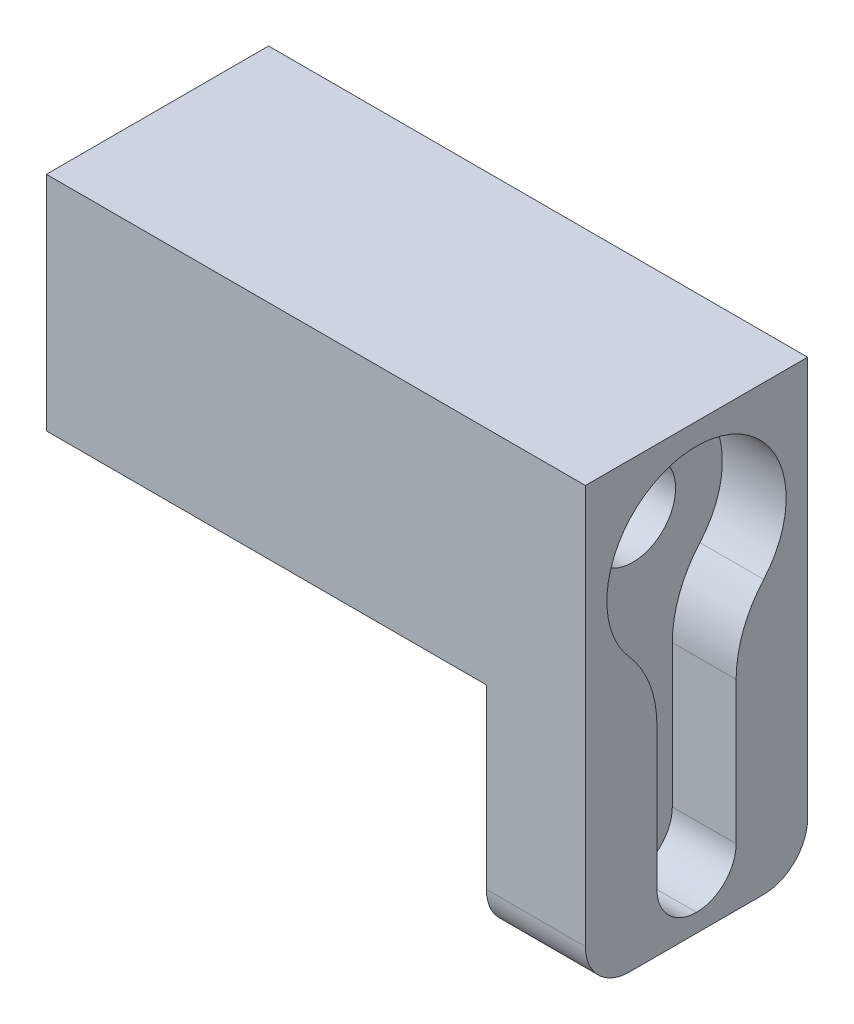
from build123d import *

# Parameters (mm, degrees)
SKETCH1_W           = 20
SKETCH1_H           = 20
BOSS_EXTRUDE1_DEPTH = 20
SKETCH2_W           = 45
SKETCH2_H           = 70
BOSS_EXTRUDE2_DEPTH = 9
CUT_EXTRUDE1_DEPTH  = 5.8
FILLET1_R           = 3.6
FILLET2_R           = 10
SKETCH5_R           = 3.9
CUT_EXTRUDE2_DEPTH  = 51.717354032
CUT_EXTRUDE3_REACH  = 49.639
SKETCH6_R           = 1.75
SKETCH7_W           = 9
SKETCH7_H           = 45
CUT_EXTRUDE4_DEPTH  = 4.8
SKETCH9_W           = 9
SKETCH9_H           = 45
CUT_EXTRUDE5_DEPTH  = 23.8
SKETCH10_W          = 12.5
SKETCH10_H          = 41.4
CUT_EXTRUDE6_DEPTH  = 23.8
SKETCH11_W          = 20
SKETCH11_H          = 1.2
CUT_EXTRUDE7_DEPTH  = 23.8
BOSS_EXTRUDE3_START = 20
SKETCH12_W          = 20
SKETCH12_H          = 20
SKETCH12_R          = 3.9
BOSS_EXTRUDE3_DEPTH = 20
SKETCH13_W          = 20.2
SKETCH13_H          = 20.2
SKETCH13_R          = 3.9
BOSS_EXTRUDE4_DEPTH = 40
SKETCH14_W          = 9
SKETCH14_H          = 20
BOSS_EXTRUDE5_DEPTH = 0.1
SKETCH15_W          = 9
SKETCH15_H          = 40.3
BOSS_EXTRUDE6_DEPTH = 0.1
SKETCH16_W          = 9
SKETCH16_H          = 40.3
BOSS_EXTRUDE7_DEPTH = 0.1
SKETCH17_R          = 4.83091966
BOSS_EXTRUDE8_DEPTH = 39
SKETCH18_R          = 3
CUT_EXTRUDE8_DEPTH  = 2
FILLET3_R           = 3.23
FILLET4_R           = 4


# Some blends are built 0.0001 mm under size
with BuildPart() as part:
    # Sketch1 → Boss-Extrude1 (new body)
    with BuildSketch(Plane(origin=(0, 0, 0), x_dir=(0, 0, -1), z_dir=(1, 0, 0))):
        Rectangle(SKETCH1_W, SKETCH1_H)
    extrude(amount=BOSS_EXTRUDE1_DEPTH)

    # Sketch2 → Boss-Extrude2 (add)
    with BuildSketch(Plane(origin=(20, 0, 0), x_dir=(0, 0, -1), z_dir=(1, 0, 0))):
        Rectangle(SKETCH2_W, SKETCH2_H)
    extrude(amount=BOSS_EXTRUDE2_DEPTH)

    # Sketch4 → Cut-Extrude1 (cut)
    with BuildSketch(Plane(origin=(29, 0, 0), x_dir=(0, 0, -1), z_dir=(1, 0, 0))):
        with BuildLine():
            Line((3.6, -28.55), (-3.6, -28.55))
            Line((-3.6, -28.55), (-3.6, -7.311805523))
            ThreePointArc((-3.6, -7.311805523), (0, 8.15), (3.6, -7.311805523))
            Line((3.6, -7.311805523), (3.6, -28.55))
        make_face()
    extrude(amount=-CUT_EXTRUDE1_DEPTH, mode=Mode.SUBTRACT)

    # Fillet1
    fillet1_edges = [part.edges().sort_by_distance(p)[0] for p in [
        (26.1, -28.55, 3.6),
        (26.1, -28.55, -3.6),
    ]]
    fillet(fillet1_edges, radius=FILLET1_R - 0.0001)  # a hair under: the kernel refuses the full size

    # Fillet2
    fillet2_edges = [part.edges().sort_by_distance(p)[0] for p in [
        (26.1, -7.311805523, 3.6),
        (26.1, -7.311805523, -3.6),
    ]]
    fillet(fillet2_edges, radius=FILLET2_R)

    # Sketch5 → Cut-Extrude2 (cut, through all)
    with BuildSketch(Plane.ZY):
        Circle(SKETCH5_R)
    extrude(amount=-CUT_EXTRUDE2_DEPTH, mode=Mode.SUBTRACT)

    # Sketch6 → Cut-Extrude3 (cut, up to next)
    with BuildSketch(Plane(origin=(23.2, 0, 0), x_dir=(0, 0, -1), z_dir=(1, 0, 0)), mode=Mode.PRIVATE) as cut_extrude3_sk1:
        with Locations((0, -20.6)):
            Circle(SKETCH6_R)
    cut_extrude3_tool1 = extrude(cut_extrude3_sk1.sketch, amount=-CUT_EXTRUDE3_REACH, mode=Mode.PRIVATE) & part.part
    add(cut_extrude3_tool1.solids().sort_by_distance((23.2, -20.6, 0))[0], mode=Mode.SUBTRACT)

    # Sketch7 → Cut-Extrude4 (cut)
    with BuildSketch(Plane.XZ.offset(35)):
        with Locations((24.5, 0)):
            Rectangle(SKETCH7_W, SKETCH7_H)
    extrude(amount=-CUT_EXTRUDE4_DEPTH, mode=Mode.SUBTRACT)

    # Sketch9 → Cut-Extrude5 (cut)
    with BuildSketch(Plane(origin=(0, 35, 0), x_dir=(1, 0, 0), z_dir=(0, 1, 0))):
        with Locations((24.5, 0)):
            Rectangle(SKETCH9_W, SKETCH9_H)
    extrude(amount=-CUT_EXTRUDE5_DEPTH, mode=Mode.SUBTRACT)

    # Sketch10 → Cut-Extrude6 (cut)
    with BuildSketch(Plane.ZY.offset(-20)):
        with Locations((-16.25, -9.5)):
            Rectangle(SKETCH10_W, SKETCH10_H)
        with Locations((16.25, -9.5)):
            Rectangle(SKETCH10_W, SKETCH10_H)
    extrude(amount=-CUT_EXTRUDE6_DEPTH, mode=Mode.SUBTRACT)

    # Sketch11 → Cut-Extrude7 (cut)
    with BuildSketch(Plane.ZY.offset(-20)):
        with Locations((0, 10.6)):
            Rectangle(SKETCH11_W, SKETCH11_H)
    extrude(amount=-CUT_EXTRUDE7_DEPTH, mode=Mode.SUBTRACT)

    # Sketch12 → Boss-Extrude3 (add)
    with BuildSketch(Plane.ZY.offset(BOSS_EXTRUDE3_START)):
        Rectangle(SKETCH12_W, SKETCH12_H)
        Circle(SKETCH12_R, mode=Mode.SUBTRACT)
    extrude(amount=-BOSS_EXTRUDE3_DEPTH)

    # Sketch13 → Boss-Extrude4 (add)
    with BuildSketch(Plane.ZY.offset(20)):
        Rectangle(SKETCH13_W, SKETCH13_H)
        Circle(SKETCH13_R, mode=Mode.SUBTRACT)
    extrude(amount=-BOSS_EXTRUDE4_DEPTH)

    # Sketch14 → Boss-Extrude5 (add)
    with BuildSketch(Plane(origin=(0, 10, 0), x_dir=(1, 0, 0), z_dir=(0, 1, 0))):
        with Locations((24.5, 0)):
            Rectangle(SKETCH14_W, SKETCH14_H)
    extrude(amount=BOSS_EXTRUDE5_DEPTH)

    # Sketch15 → Boss-Extrude6 (add)
    with BuildSketch(Plane.XY.offset(10)):
        with Locations((24.5, -10.05)):
            Rectangle(SKETCH15_W, SKETCH15_H)
    extrude(amount=BOSS_EXTRUDE6_DEPTH)

    # Sketch16 → Boss-Extrude7 (add)
    with BuildSketch(Plane(origin=(0, 0, -10), x_dir=(-1, 0, 0), z_dir=(0, 0, -1))):
        with Locations((-24.5, -10.05)):
            Rectangle(SKETCH16_W, SKETCH16_H)
    extrude(amount=BOSS_EXTRUDE7_DEPTH)

    # Sketch17 → Boss-Extrude8 (add)
    with BuildSketch(Plane.ZY.offset(20)):
        Circle(SKETCH17_R)
    extrude(amount=-BOSS_EXTRUDE8_DEPTH)

    # Sketch18 → Cut-Extrude8 (cut)
    with BuildSketch(Plane.ZY.offset(20)):
        Circle(SKETCH18_R)
    extrude(amount=-CUT_EXTRUDE8_DEPTH, mode=Mode.SUBTRACT)

    # Fillet3
    # the kernel refuses this fillet: 3.23 mm, written as the material it adds along each edge
    with BuildSketch(Plane(origin=(-18, 0, 0), x_dir=(0, 0, 1), z_dir=(0, -1, 0))) as fillet3_piece_1:
        with BuildLine():
            CenterArc((0.013363095, 3.23), FILLET3_R, 270, 67.616447755)
            Line((0.013363095, 0), (0.013363095, -0.0646))
            Line((0.013363095, -0.0646), (3, -0.0646))
            Line((3, -0.0646), (3.0646, 0))
            ThreePointArc((3.0646, 0), (3.0646, 1), (3.059732738, 1.9754))
            Line((3.059732738, 1.9754), (3, 2))
        make_face()
    revolve(axis=Axis((-18, 0, 0), (-1, 0, 0)))

    # Fillet4
    fillet4_edges = [part.edges().sort_by_distance(p)[0] for p in [
        (24.5, -30.2, 10.1),
        (24.5, -30.2, -10.1),
    ]]
    fillet(fillet4_edges, radius=FILLET4_R)


solid = part.part
